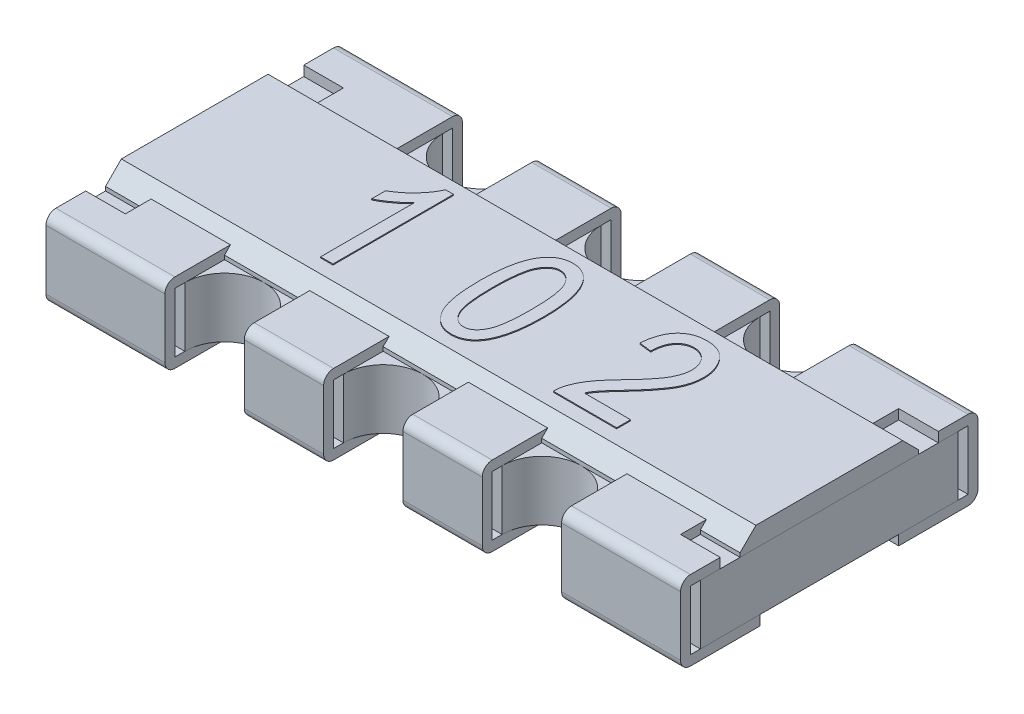
from build123d import *

# Parameters (mm, degrees)
EXTRUDE_THIN1_DEPTH = 1.6
SKETCH6_W           = 0.4
SKETCH6_H           = 0.5
CUT_EXTRUDE3_DEPTH  = 2.811767093
SKETCH7_W           = 0.2
SKETCH7_H           = 1.1
CUT_EXTRUDE4_DEPTH  = 0.1
SKETCH1_W           = 3.2
SKETCH1_H           = 1.3
BOSS_EXTRUDE3_DEPTH = 0.3
SKETCH9_W           = 3.2
SKETCH9_H           = 0.9
BOSS_EXTRUDE4_DEPTH = 0.1
CHAMFER1_START      = -3
CHAMFER1_DEPTH      = 6
CHAMFER1_START_2    = -1
CHAMFER1_2_DEPTH    = 0.4
CHAMFER1_START_3    = -0.2
CHAMFER1_3_DEPTH    = 0.4
CHAMFER1_START_4    = 0.6
CHAMFER1_4_DEPTH    = 0.4
CHAMFER1_5_DEPTH    = 1.6
CHAMFER1_START_5    = 1.4
CHAMFER1_6_DEPTH    = 1.6
SKETCH10_R          = 0.2
CUT_EXTRUDE7_DEPTH  = 5
BOSS_EXTRUDE5_DEPTH = 0.005


with BuildPart() as part:
    # Sketch5 → Extrude-Thin1 (new, symmetric)
    with BuildSketch(Plane(origin=(0, 0, 0), x_dir=(0, 0, -1), z_dir=(1, 0, 0))):
        with BuildLine():
            Line((-0.35, 0), (-0.7, 0))
            ThreePointArc((-0.7, 0), (-0.735355339, 0.014644661), (-0.75, 0.05))
            Line((-0.75, 0.05), (-0.75, 0.35))
            ThreePointArc((-0.75, 0.35), (-0.735355339, 0.385355339), (-0.7, 0.4))
            Line((-0.7, 0.4), (0.7, 0.4))
            ThreePointArc((0.7, 0.4), (0.735355339, 0.385355339), (0.75, 0.35))
            Line((0.75, 0.35), (0.75, 0.05))
            ThreePointArc((0.75, 0.05), (0.735355339, 0.014644661), (0.7, 0))
            Line((0.7, 0), (0.35, 0))
            Line((0.35, 0), (0.35, 0.05))
            Line((0.35, 0.05), (0.7, 0.05))
            Line((0.7, 0.05), (0.7, 0.35))
            Line((0.7, 0.35), (-0.7, 0.35))
            Line((-0.7, 0.35), (-0.7, 0.05))
            Line((-0.7, 0.05), (-0.35, 0.05))
            Line((-0.35, 0.05), (-0.35, 0))
        make_face()
    extrude(amount=EXTRUDE_THIN1_DEPTH, both=True)

    # Sketch6 → Cut-Extrude3 (cut, through all)
    with BuildSketch(Plane(origin=(0, 0.4, 0), x_dir=(1, 0, 0), z_dir=(0, 1, 0))):
        with Locations((-0.8, 0.5)):
            Rectangle(SKETCH6_W, SKETCH6_H)
        with Locations((0, 0.5)):
            Rectangle(SKETCH6_W, SKETCH6_H)
        with Locations((0.8, 0.5)):
            Rectangle(SKETCH6_W, SKETCH6_H)
        with Locations((-0.8, -0.5)):
            Rectangle(SKETCH6_W, SKETCH6_H)
        with Locations((0, -0.5)):
            Rectangle(SKETCH6_W, SKETCH6_H)
        with Locations((0.8, -0.5)):
            Rectangle(SKETCH6_W, SKETCH6_H)
    extrude(amount=-CUT_EXTRUDE3_DEPTH, mode=Mode.SUBTRACT)

    # Sketch7 → Cut-Extrude4 (cut)
    with BuildSketch(Plane(origin=(0, 0.4, 0), x_dir=(1, 0, 0), z_dir=(0, 1, 0))):
        with Locations((-1.5, 0)):
            Rectangle(SKETCH7_W, SKETCH7_H)
        with Locations((1.5, 0)):
            Rectangle(SKETCH7_W, SKETCH7_H)
    extrude(amount=-CUT_EXTRUDE4_DEPTH, mode=Mode.SUBTRACT)

    # Sketch9 → Boss-Extrude4 (add)
    with BuildSketch(Plane(origin=(0, 0.35, 0), x_dir=(1, 0, 0), z_dir=(0, 1, 0))):
        Rectangle(SKETCH9_W, SKETCH9_H)
    extrude(amount=BOSS_EXTRUDE4_DEPTH)

    # Chamfer1: read off the stored shape, not the designer's step
    # Chamfer1 outline → Chamfer1 (cut)
    with BuildSketch(Plane.YZ.offset(CHAMFER1_START)):
        Polygon((0.45, 0.45), (0.4, 0.45), (0.4, 0.42), (0.45, 0.37), align=None)
        Polygon((0.45, -0.45), (0.45, -0.37), (0.4, -0.42), (0.4, -0.45), align=None)
    extrude(amount=CHAMFER1_DEPTH, mode=Mode.SUBTRACT)

    # Chamfer1 2 outline → Chamfer1 2 (cut)
    with BuildSketch(Plane.YZ.offset(CHAMFER1_START_2)):
        Polygon((0.4, 0.42), (0.4, 0.45), (0.37, 0.45), align=None)
        Polygon((0.4, -0.45), (0.4, -0.42), (0.37, -0.45), align=None)
    extrude(amount=CHAMFER1_2_DEPTH, mode=Mode.SUBTRACT)

    # Chamfer1 3 outline → Chamfer1 3 (cut)
    with BuildSketch(Plane.YZ.offset(CHAMFER1_START_3)):
        Polygon((0.4, 0.42), (0.4, 0.45), (0.37, 0.45), align=None)
        Polygon((0.4, -0.45), (0.4, -0.42), (0.37, -0.45), align=None)
    extrude(amount=CHAMFER1_3_DEPTH, mode=Mode.SUBTRACT)

    # Chamfer1 4 outline → Chamfer1 4 (cut)
    with BuildSketch(Plane.YZ.offset(CHAMFER1_START_4)):
        Polygon((0.4, 0.42), (0.4, 0.45), (0.37, 0.45), align=None)
        Polygon((0.4, -0.45), (0.4, -0.42), (0.37, -0.45), align=None)
    extrude(amount=CHAMFER1_4_DEPTH, mode=Mode.SUBTRACT)

    # Chamfer1 5 outline → Chamfer1 5 (cut)
    with BuildSketch(Plane.YZ.offset(CHAMFER1_START)):
        Polygon((0.4, 0.42), (0.4, 0.45), (0.37, 0.45), align=None)
        Polygon((0.4, -0.45), (0.4, -0.42), (0.37, -0.45), align=None)
    extrude(amount=CHAMFER1_5_DEPTH, mode=Mode.SUBTRACT)

    # Chamfer1 6 outline → Chamfer1 6 (cut)
    with BuildSketch(Plane.YZ.offset(CHAMFER1_START_5)):
        Polygon((0.4, 0.42), (0.4, 0.45), (0.37, 0.45), align=None)
        Polygon((0.4, -0.45), (0.4, -0.42), (0.37, -0.45), align=None)
    extrude(amount=CHAMFER1_6_DEPTH, mode=Mode.SUBTRACT)

    # Sketch11 → Boss-Extrude5 (add)
    # profile 1 of 3: a face of its own
    with BuildSketch(Plane(origin=(0, 0.45, 0), x_dir=(1, 0, 0), z_dir=(0, 1, 0))):
        with BuildLine():
            Line((-0.602857143, -0.3), (-0.665194805, -0.3))
            Line((-0.665194805, -0.3), (-0.665194805, 0.175324675))
            add(Edge.make_bspline(
                [(-0.665194805, 0.175324675), (-0.669023189, 0.170917878), (-0.676957509, 0.161784794), (-0.690731083, 0.148796276), (-0.70608021, 0.135402465), (-0.72307373, 0.122405736), (-0.740388775, 0.109956973), (-0.7574906, 0.099008069), (-0.773738236, 0.089481697), (-0.784638106, 0.084303674), (-0.78987013, 0.081818182)],
                knots=[0, 0, 0, 0, 0.892555828, 1.849821039, 2.893015883, 4.008277588, 5.121255548, 6.154629642, 7.114207698, 8, 8, 8, 8], degree=3))
            Line((-0.78987013, 0.081818182), (-0.78987013, 0.151948052))
            add(Edge.make_bspline(
                [(-0.78987013, 0.151948052), (-0.781461846, 0.157008477), (-0.764717276, 0.167085997), (-0.741255942, 0.184543515), (-0.719092323, 0.203386035), (-0.698888884, 0.223810986), (-0.680798923, 0.244866052), (-0.665271894, 0.265879035), (-0.652540714, 0.286626673), (-0.646295662, 0.300898654), (-0.643279221, 0.307792208)],
                knots=[0, 0, 0, 0, 1.082272232, 2.155277244, 3.222407096, 4.289527553, 5.32168536, 6.282742408, 7.170542132, 8, 8, 8, 8], degree=3))
            Line((-0.643279221, 0.307792208), (-0.602857143, 0.307792208))
            Line((-0.602857143, 0.307792208), (-0.602857143, -0.3))
        make_face()
    # profile 2 of 3: a face of its own
    with BuildSketch(Plane(origin=(0, 0.45, 0), x_dir=(1, 0, 0), z_dir=(0, 1, 0))):
        with BuildLine():
            add(Edge.make_bspline(
                [(-0.16025974, -0.000243506), (-0.16016075, 0.012015777), (-0.159968535, 0.035820356), (-0.157982034, 0.070346204), (-0.154848735, 0.102601016), (-0.15058787, 0.132541542), (-0.144821292, 0.160172278), (-0.13803057, 0.185537553), (-0.129690209, 0.208556703), (-0.120302618, 0.229328432), (-0.109537209, 0.247736757), (-0.097668802, 0.263844935), (-0.084345335, 0.277391531), (-0.069934188, 0.288656053), (-0.05414867, 0.297237647), (-0.037213457, 0.303405064), (-0.019065947, 0.307126735), (-0.00654353, 0.307567379), (-0.000154221, 0.307792208)],
                knots=[0, 0, 0, 0, 1.522295809, 2.955932353, 4.292935845, 5.545987552, 6.709403679, 7.796379217, 8.803980711, 9.746667296, 10.623167879, 11.447716403, 12.224665142, 12.975696349, 13.710987297, 14.4460191, 15.207112772, 16, 16, 16, 16], degree=3))
            add(Edge.make_bspline(
                [(-0.000154221, 0.307792208), (0.005539674, 0.307609551), (0.016721181, 0.307250856), (0.033037828, 0.304292851), (0.048384688, 0.299260592), (0.062773354, 0.292267251), (0.076160119, 0.283238219), (0.088676691, 0.272320992), (0.100185908, 0.259295457), (0.106850379, 0.249510217), (0.110275974, 0.244480519)],
                knots=[0, 0, 0, 0, 1.02435884, 2.0116063, 2.972586715, 3.92329494, 4.881606269, 5.870473939, 6.905405214, 8, 8, 8, 8], degree=3))
            add(Edge.make_bspline(
                [(0.110275974, 0.244480519), (0.114241198, 0.237699348), (0.122487301, 0.223597187), (0.132333547, 0.199969325), (0.140633024, 0.173578987), (0.147630806, 0.144342182), (0.152622484, 0.112198627), (0.156573091, 0.077273355), (0.158859509, 0.03947858), (0.159097468, 0.013314744), (0.159220779, -0.000243506)],
                knots=[0, 0, 0, 0, 0.745747152, 1.550859881, 2.42529298, 3.372802996, 4.404287875, 5.514077945, 6.711780846, 8, 8, 8, 8], degree=3))
            add(Edge.make_bspline(
                [(0.159220779, -0.000243506), (0.159122989, -0.012421777), (0.158933141, -0.03606444), (0.156926761, -0.070425861), (0.153835208, -0.102523934), (0.149516471, -0.132373142), (0.143803372, -0.159936044), (0.136922421, -0.185294421), (0.128842351, -0.208437046), (0.119324816, -0.22921099), (0.108717883, -0.247726715), (0.096648142, -0.263671661), (0.083645771, -0.277460381), (0.069047561, -0.288480915), (0.053369749, -0.297305411), (0.036320403, -0.30336888), (0.0181124, -0.307142713), (0.005546574, -0.307572327), (-0.00088474, -0.307792208)],
                knots=[0, 0, 0, 0, 1.513874866, 2.939007974, 4.277477108, 5.521918538, 6.686610019, 7.774777114, 8.786532326, 9.730252297, 10.61206932, 11.433487149, 12.211385775, 12.960169701, 13.698700869, 14.439280195, 15.201208188, 16, 16, 16, 16], degree=3))
            add(Edge.make_bspline(
                [(-0.00088474, -0.307792208), (-0.006620975, -0.307576906), (-0.017899057, -0.307153597), (-0.034446971, -0.303935108), (-0.050108669, -0.298385836), (-0.064966882, -0.290762001), (-0.079041361, -0.281014996), (-0.092160144, -0.268939509), (-0.104640182, -0.254853409), (-0.116331379, -0.238497003), (-0.126896155, -0.21944985), (-0.135826783, -0.197258593), (-0.143435404, -0.172029234), (-0.149473213, -0.143659916), (-0.154555234, -0.112266591), (-0.157749089, -0.077691802), (-0.159866014, -0.040002266), (-0.16012507, -0.013842592), (-0.16025974, -0.000243506)],
                knots=[0, 0, 0, 0, 0.713782411, 1.403376538, 2.088831486, 2.775699897, 3.476400496, 4.213162367, 4.989742879, 5.815463779, 6.710980744, 7.6941898, 8.787315853, 9.987366569, 11.302150399, 12.743876293, 14.307306722, 16, 16, 16, 16], degree=3))
        make_face()
        with BuildLine():
            add(Edge.make_bspline(
                [(-0.097922078, 0), (-0.09781338, -0.011689148), (-0.097605735, -0.03401889), (-0.096464605, -0.066062392), (-0.094307757, -0.095061839), (-0.091312117, -0.121108605), (-0.087514137, -0.144095099), (-0.082826557, -0.164147878), (-0.077240844, -0.181185404), (-0.070669253, -0.195450259), (-0.063381813, -0.207291922), (-0.055597887, -0.217382418), (-0.047549551, -0.226133567), (-0.038751625, -0.23312396), (-0.029617724, -0.238776185), (-0.019794899, -0.242464275), (-0.009629637, -0.245126312), (-0.002607009, -0.245344363), (0.000941558, -0.245454545)],
                knots=[0, 0, 0, 0, 1.930873368, 3.688541263, 5.295281011, 6.732986767, 8.018032389, 9.141589856, 10.131594649, 10.974379403, 11.729767228, 12.422984227, 13.077418253, 13.687793181, 14.274134012, 14.843047171, 15.415386244, 16, 16, 16, 16], degree=3))
            add(Edge.make_bspline(
                [(0.000941558, -0.245454545), (0.004286618, -0.245339019), (0.010947164, -0.245108988), (0.020656142, -0.242474129), (0.030016043, -0.238609085), (0.038869562, -0.233015381), (0.047203985, -0.225820788), (0.05513227, -0.2170859), (0.062666223, -0.206801116), (0.069890832, -0.194781881), (0.076392603, -0.180444557), (0.081922857, -0.16332607), (0.086576263, -0.143279724), (0.090425464, -0.120305193), (0.09321409, -0.094361409), (0.095446667, -0.065537108), (0.09655817, -0.033734202), (0.096771695, -0.011567184), (0.096883117, 0)],
                knots=[0, 0, 0, 0, 0.556098029, 1.107279675, 1.665020537, 2.239289732, 2.843790749, 3.494855459, 4.20099618, 4.965402842, 5.827994078, 6.818278647, 7.958442113, 9.254955883, 10.697998423, 12.305588537, 14.072183745, 16, 16, 16, 16], degree=3))
            add(Edge.make_bspline(
                [(0.096883117, 0), (0.096772191, 0.011689009), (0.09655952, 0.034099592), (0.095442947, 0.066185486), (0.093246964, 0.095262011), (0.090304323, 0.121276443), (0.086433544, 0.144288037), (0.081838803, 0.164326816), (0.07616176, 0.18133006), (0.069683494, 0.195566462), (0.062247728, 0.207302783), (0.054655661, 0.217546435), (0.046335854, 0.226081067), (0.037590838, 0.233187792), (0.028293251, 0.238725611), (0.018402294, 0.242682832), (0.007994868, 0.245064097), (0.000872584, 0.245323849), (-0.002711039, 0.245454545)],
                knots=[0, 0, 0, 0, 1.926173374, 3.692928135, 5.28908838, 6.72993665, 8.005261178, 9.132588719, 10.113846285, 10.954579593, 11.702439438, 12.399284011, 13.051919516, 13.660808713, 14.251466784, 14.827675714, 15.41013748, 16, 16, 16, 16], degree=3))
            add(Edge.make_bspline(
                [(-0.002711039, 0.245454545), (-0.006056643, 0.245342071), (-0.012678843, 0.245119442), (-0.022307096, 0.242473478), (-0.031543981, 0.238604635), (-0.040332643, 0.232986049), (-0.048562185, 0.225690063), (-0.056554764, 0.217009276), (-0.063923487, 0.206631738), (-0.071174589, 0.194722533), (-0.077562343, 0.180346863), (-0.083101176, 0.163258155), (-0.087555995, 0.143175847), (-0.091492547, 0.120270448), (-0.094245537, 0.094359818), (-0.096487948, 0.065537599), (-0.097596465, 0.033734061), (-0.097810428, 0.011567136), (-0.097922078, 0)],
                knots=[0, 0, 0, 0, 0.557102101, 1.102712893, 1.655222221, 2.224793741, 2.834805151, 3.487045402, 4.190458401, 4.956245252, 5.811421647, 6.809929224, 7.950602775, 9.242777249, 10.688425301, 12.298918027, 14.068702942, 16, 16, 16, 16], degree=3))
        make_face(mode=Mode.SUBTRACT)
    # profile 3 of 3: a face of its own
    with BuildSketch(Plane(origin=(0, 0.45, 0), x_dir=(1, 0, 0), z_dir=(0, 1, 0))):
        with BuildLine():
            Line((0.827792208, -0.22987013), (0.827792208, -0.3))
            Line((0.827792208, -0.3), (0.508311688, -0.3))
            add(Edge.make_bspline(
                [(0.508311688, -0.3), (0.508296896, -0.29634594), (0.508266927, -0.288942756), (0.509263307, -0.277655947), (0.511310454, -0.266095879), (0.513924452, -0.254108337), (0.517630817, -0.241850984), (0.522168094, -0.229264262), (0.527521683, -0.216379506), (0.533790247, -0.203120409), (0.541115379, -0.189359788), (0.549954691, -0.175155214), (0.560113252, -0.160251889), (0.571604497, -0.144740669), (0.584653168, -0.128768659), (0.598871966, -0.112098757), (0.614463812, -0.094765682), (0.62556524, -0.08324596), (0.631282468, -0.077313312)],
                knots=[0, 0, 0, 0, 0.672188691, 1.361865275, 2.08134618, 2.831455259, 3.618325166, 4.435686407, 5.292818481, 6.184803937, 7.133719261, 8.159707436, 9.261705982, 10.452168352, 11.710682541, 13.056179633, 14.483934645, 16, 16, 16, 16], degree=3))
            add(Edge.make_bspline(
                [(0.631282468, -0.077313312), (0.637926527, -0.07044117), (0.650719145, -0.057209395), (0.668723535, -0.037671868), (0.685082331, -0.01951198), (0.699468695, -0.002401346), (0.712138039, 0.013426992), (0.723217828, 0.027950404), (0.732178562, 0.041498488), (0.741853606, 0.057439754), (0.751077386, 0.07641758), (0.75923173, 0.098539238), (0.76450048, 0.119924299), (0.765142715, 0.134023014), (0.765454545, 0.140868506)],
                knots=[0, 0, 0, 0, 1.312560889, 2.527233899, 3.64818266, 4.668586789, 5.596397896, 6.432357998, 7.175835261, 7.825761013, 8.992224112, 10.065918602, 11.060925749, 12, 12, 12, 12], degree=3))
            add(Edge.make_bspline(
                [(0.765454545, 0.140868506), (0.765411065, 0.144647763), (0.765326143, 0.152029047), (0.763883012, 0.162808623), (0.761824916, 0.17306167), (0.759107621, 0.182862287), (0.755254809, 0.192049498), (0.750638491, 0.200687044), (0.745231129, 0.208814046), (0.739060508, 0.216311155), (0.732255717, 0.223074484), (0.725084422, 0.229150486), (0.717360067, 0.23406812), (0.709400126, 0.23834902), (0.700935617, 0.241451555), (0.69214478, 0.243816488), (0.682946282, 0.245149945), (0.676700438, 0.245352005), (0.673530844, 0.245454545)],
                knots=[0, 0, 0, 0, 1.164486654, 2.274364258, 3.346924328, 4.388668322, 5.404300818, 6.412115579, 7.404820287, 8.409522099, 9.400647826, 10.360464378, 11.301161788, 12.219192522, 13.141987859, 14.073903283, 15.022558797, 16, 16, 16, 16], degree=3))
            add(Edge.make_bspline(
                [(0.673530844, 0.245454545), (0.6701134, 0.245382852), (0.663442392, 0.245242902), (0.653718963, 0.243503706), (0.644402132, 0.241177006), (0.635539177, 0.237568496), (0.627194926, 0.232946215), (0.619249176, 0.227382421), (0.611857455, 0.220771945), (0.604870862, 0.213255043), (0.598746224, 0.204683392), (0.593122908, 0.195407929), (0.588694783, 0.185035745), (0.584929599, 0.173886667), (0.581980868, 0.161830733), (0.580009876, 0.148913412), (0.578564451, 0.135137852), (0.578483276, 0.125653456), (0.578441558, 0.120779221)],
                knots=[0, 0, 0, 0, 0.928788257, 1.813037313, 2.680996359, 3.53827917, 4.408273621, 5.272359245, 6.172129225, 7.102295458, 8.058839945, 9.034325244, 10.048074492, 11.120300332, 12.234644845, 13.420320921, 14.674247329, 16, 16, 16, 16], degree=3))
            Line((0.578441558, 0.120779221), (0.516103896, 0.128571429))
            add(Edge.make_bspline(
                [(0.516103896, 0.128571429), (0.516746316, 0.135805219), (0.51799264, 0.1498391), (0.521262647, 0.170155322), (0.52580037, 0.189005136), (0.531186931, 0.206576592), (0.537963846, 0.22265162), (0.545540651, 0.237522766), (0.55452098, 0.250866759), (0.564535528, 0.262848567), (0.575500428, 0.273478874), (0.58735388, 0.282654717), (0.600079788, 0.290389779), (0.61353282, 0.296893719), (0.627991059, 0.301750572), (0.643195122, 0.305275566), (0.65926867, 0.307363942), (0.670237381, 0.307647344), (0.675844156, 0.307792208)],
                knots=[0, 0, 0, 0, 1.296155121, 2.514599762, 3.669097984, 4.755193195, 5.79120272, 6.77953026, 7.729955905, 8.65570694, 9.562583864, 10.450894749, 11.325630111, 12.216772649, 13.112585423, 14.04224033, 14.999270054, 16, 16, 16, 16], degree=3))
            add(Edge.make_bspline(
                [(0.675844156, 0.307792208), (0.68189785, 0.307614508), (0.693685398, 0.307268497), (0.71084529, 0.304988562), (0.726850026, 0.30096691), (0.741771094, 0.295370719), (0.755429295, 0.288003487), (0.768046794, 0.279166292), (0.779413018, 0.26859049), (0.78952792, 0.256556721), (0.79846695, 0.243564822), (0.806266838, 0.229979764), (0.813032615, 0.216026648), (0.81832026, 0.201550217), (0.822736007, 0.186744753), (0.825510076, 0.171385827), (0.827463, 0.155650651), (0.827681852, 0.14501432), (0.827792208, 0.139650974)],
                knots=[0, 0, 0, 0, 1.141256367, 2.222215694, 3.255808886, 4.246221905, 5.218350639, 6.173592628, 7.142736081, 8.136099926, 9.131465336, 10.11177911, 11.087094076, 12.050634184, 13.014356534, 13.995714735, 14.989343724, 16, 16, 16, 16], degree=3))
            add(Edge.make_bspline(
                [(0.827792208, 0.139650974), (0.827688232, 0.134818834), (0.827481634, 0.125217509), (0.826137701, 0.110891788), (0.823765409, 0.096758665), (0.820685093, 0.082682246), (0.816314104, 0.068880484), (0.81136591, 0.055134173), (0.805364135, 0.041598391), (0.798278891, 0.028008922), (0.78998299, 0.013884868), (0.780041757, -0.001031552), (0.768639552, -0.017139058), (0.755313237, -0.034150651), (0.740708536, -0.052555537), (0.724180239, -0.071889966), (0.706050823, -0.092324433), (0.693278122, -0.106189874), (0.686680195, -0.113352273)],
                knots=[0, 0, 0, 0, 0.78053567, 1.550902233, 2.321464013, 3.094364546, 3.87611052, 4.657966429, 5.453363508, 6.265521698, 7.132350641, 8.097801917, 9.160103787, 10.319208993, 11.587678713, 12.955014444, 14.427067756, 16, 16, 16, 16], degree=3))
            add(Edge.make_bspline(
                [(0.686680195, -0.113352273), (0.682491605, -0.117808728), (0.674486873, -0.126325373), (0.663151214, -0.138649064), (0.652979052, -0.149859773), (0.643748922, -0.159799674), (0.635917138, -0.168803044), (0.629127076, -0.176632049), (0.623579073, -0.183383189), (0.615264359, -0.193996402), (0.604777351, -0.208950323), (0.597532107, -0.223047968), (0.594025974, -0.22987013)],
                knots=[0, 0, 0, 0, 1.227496676, 2.345844757, 3.360613726, 4.265798447, 5.068085109, 5.75545707, 6.345771879, 6.821573405, 8.46188917, 10, 10, 10, 10], degree=3))
            Line((0.594025974, -0.22987013), (0.827792208, -0.22987013))
        make_face()
    extrude(amount=BOSS_EXTRUDE5_DEPTH)


with BuildPart() as body_2:
    # Sketch1 → Boss-Extrude3 (new body)
    with BuildSketch(Plane(origin=(0, 0.05, 0), x_dir=(1, 0, 0), z_dir=(0, 1, 0))):
        Rectangle(SKETCH1_W, SKETCH1_H)
    extrude(amount=BOSS_EXTRUDE3_DEPTH)

    # Sketch10 → Cut-Extrude7 (cut)
    with BuildSketch(Plane(origin=(0, 0.05, 0), x_dir=(1, 0, 0), z_dir=(0, 1, 0))):
        with Locations((-0.8, 0.65)):
            Circle(SKETCH10_R)
        with Locations((0, 0.65)):
            Circle(SKETCH10_R)
        with Locations((0.8, 0.65)):
            Circle(SKETCH10_R)
        with Locations((0.8, -0.65)):
            Circle(SKETCH10_R)
        with Locations((0, -0.65)):
            Circle(SKETCH10_R)
        with Locations((-0.8, -0.65)):
            Circle(SKETCH10_R)
    extrude(amount=CUT_EXTRUDE7_DEPTH, mode=Mode.SUBTRACT)


solid = Compound([part.part, body_2.part])
